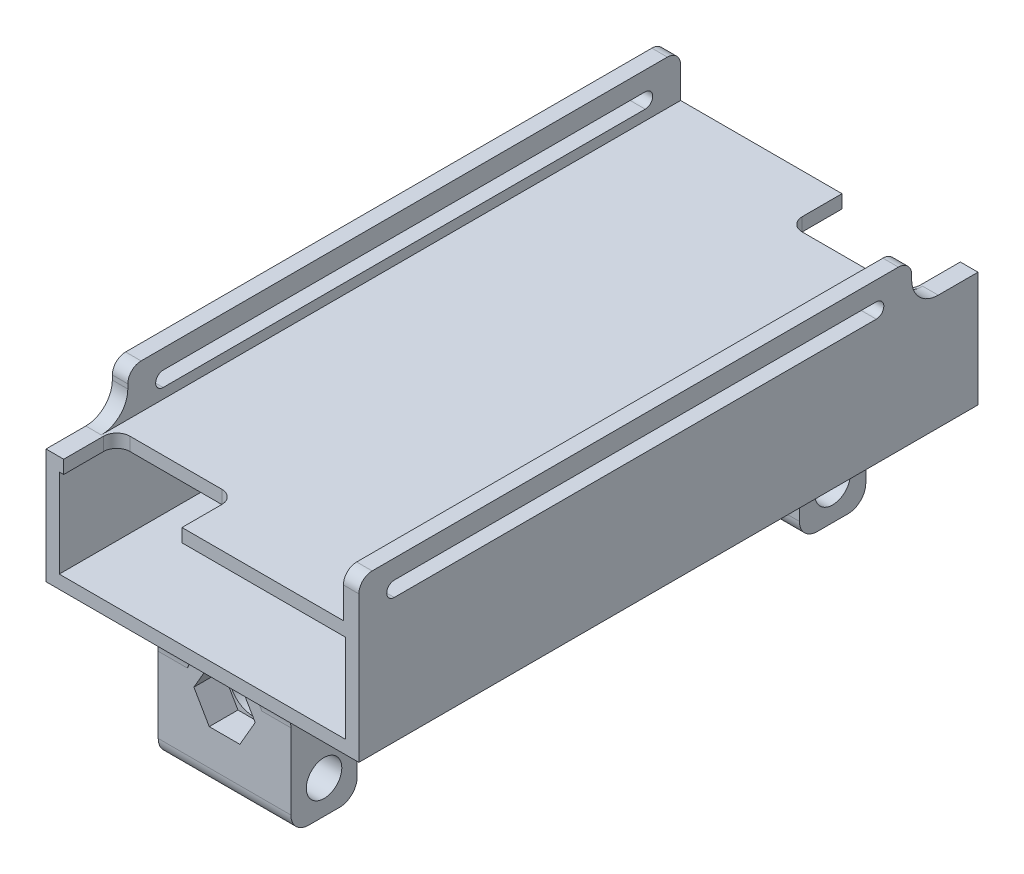
from build123d import *

# Parameters (mm, degrees)
SKETCH1_W            = 64.75
SKETCH1_H            = 20
BODY_DEPTH           = 140
SHELL1_T             = 3
SWITCH_CUTOUT_REACH  = 148.722
SKETCH2_W            = 26.75
SKETCH2_H            = 12
SKETCH4_W            = 15
SKETCH4_H            = 27
SKETCH4_R            = 4.0125
AXLE_HOLDER_DEPTH    = 15
SKETCH5_R            = 4.0125
SKETCH5_R_2          = 2.5
BUSHING_HOLDER_DEPTH = 9
FILLET3_R            = 4
FILLET4_R            = 6
SKETCH6_W            = 125
SKETCH6_H            = 10
SLIDE_MOUNT_DEPTH    = 3.5
CIRPATTERN1_COUNT    = 2
FILLET6_R            = 3
FILLET7_R            = 3
FILLET8_R            = 6
CUT_EXTRUDE1_REACH   = 147.177
SKETCH7_R            = 5.5
SKETCH8_R            = 8.916079783
CUT_EXTRUDE2_DEPTH   = 9
CUT_EXTRUDE3_DEPTH   = 3.5
CUT_EXTRUDE4_DEPTH   = 6.5


with BuildPart() as part:
    # Sketch1 → Body (new body)
    with BuildSketch(Plane.XY):
        Rectangle(SKETCH1_W, SKETCH1_H)
    extrude(amount=BODY_DEPTH)

    # Shell1
    shell1_openings = [part.faces().sort_by_distance(p)[0] for p in [
        (0, 0, 0),
        (0, 0, 140),
    ]]
    offset(amount=SHELL1_T, openings=shell1_openings, kind=Kind.INTERSECTION)

    # Sketch2 → Switch_cutout (cut, up to next)
    with BuildSketch(Plane(origin=(0, 13, 0), x_dir=(1, 0, 0), z_dir=(0, 1, 0)), mode=Mode.PRIVATE) as switch_cutout_sk1:
        with Locations((18, -6)):
            Rectangle(SKETCH2_W, SKETCH2_H)
    switch_cutout_tool1 = extrude(switch_cutout_sk1.sketch, amount=-SWITCH_CUTOUT_REACH, mode=Mode.PRIVATE) & part.part
    # Sketch2 → Switch_cutout (cut, up to next)
    with BuildSketch(Plane(origin=(0, 13, 0), x_dir=(1, 0, 0), z_dir=(0, 1, 0)), mode=Mode.PRIVATE) as switch_cutout_sk2:
        with Locations((-18, -134)):
            Rectangle(SKETCH2_W, SKETCH2_H)
    switch_cutout_tool2 = extrude(switch_cutout_sk2.sketch, amount=-SWITCH_CUTOUT_REACH, mode=Mode.PRIVATE) & part.part
    add(switch_cutout_tool1.solids().sort_by_distance((18, 13, 6))[0], mode=Mode.SUBTRACT)
    add(switch_cutout_tool2.solids().sort_by_distance((-18, 13, 134))[0], mode=Mode.SUBTRACT)

    # Sketch4 → Axle_holder (add, symmetric)
    # profile 1 of 2: a face of its own
    with BuildSketch(Plane.ZY):
        with Locations((12.5, -26.5)):
            Rectangle(SKETCH4_W, SKETCH4_H)
        with Locations(Location((12.5, -32.5, 0), (0, 0, 270))):
            Circle(SKETCH4_R, mode=Mode.SUBTRACT)
    # profile 2 of 2: a face of its own
    with BuildSketch(Plane.ZY):
        with Locations((127.5, -26.5)):
            Rectangle(SKETCH4_W, SKETCH4_H)
        with Locations(Location((127.5, -32.5, 0), (0, 0, 90))):
            Circle(SKETCH4_R, mode=Mode.SUBTRACT)
    extrude(amount=AXLE_HOLDER_DEPTH, both=True)

    # Sketch5 → Bushing_holder (add, symmetric)
    # profile 1 of 2: a face of its own
    with BuildSketch(Plane.ZY):
        with Locations(Location((12.5, -32.5, 0), (0, 0, 270))):
            Circle(SKETCH5_R)
        with Locations(Location((12.5, -32.5, 0), (0, 0, 270))):
            Circle(SKETCH5_R_2, mode=Mode.SUBTRACT)
    # profile 2 of 2: a face of its own
    with BuildSketch(Plane.ZY):
        with Locations(Location((127.5, -32.5, 0), (0, 0, 90))):
            Circle(SKETCH5_R)
        with Locations(Location((127.5, -32.5, 0), (0, 0, 270))):
            Circle(SKETCH5_R_2, mode=Mode.SUBTRACT)
    extrude(amount=BUSHING_HOLDER_DEPTH, both=True)

    # Fillet3
    fillet3_edges = [part.edges().sort_by_distance(p)[0] for p in [
        (0, -40, 5),
        (0, -40, 20),
        (0, -40, 135),
        (0, -40, 120),
    ]]
    fillet(fillet3_edges, radius=FILLET3_R)

    # Fillet4
    # the kernel refuses this fillet: 6 mm, written as the material it adds along each edge
    with BuildSketch(Plane(origin=(15, -13, 5), x_dir=(0, 0, -1), z_dir=(-1, 0, 0))) as fillet4_piece_1:
        with BuildLine():
            CenterArc((6, 5.916079783), FILLET4_R, 180, 80.405931773)
            Line((0, 5.916079783), (-0.12, 5.916079783))
            Line((-0.12, 5.916079783), (-0.12, 0))
            Line((-0.12, 0), (0, -0.12))
            ThreePointArc((0, -0.12), (2.5, -0.12), (4.98, -0.118321596))
            Line((4.98, -0.118321596), (5, 0))
        make_face()
    extrude(amount=30)
    with BuildSketch(Plane(origin=(-15, -13, 20), x_dir=(0, 0, 1), z_dir=(1, 0, 0)), Plane(origin=(-15, -13, 120), x_dir=(0, -1, 0), z_dir=(1, 0, 0))) as fillet4_piece_2:
        with BuildLine():
            CenterArc((FILLET4_R, FILLET4_R), FILLET4_R, 180, 90)
            Line((0, FILLET4_R), (-FILLET4_R * 0.02, FILLET4_R))
            Line((-FILLET4_R * 0.02, FILLET4_R), (-FILLET4_R * 0.02, -FILLET4_R * 0.02))
            Line((-FILLET4_R * 0.02, -FILLET4_R * 0.02), (FILLET4_R, -FILLET4_R * 0.02))
            Line((FILLET4_R, -FILLET4_R * 0.02), (FILLET4_R, 0))
        make_face()
    extrude(amount=30)
    with BuildSketch(Plane(origin=(15, -13, 135), x_dir=(0, 0, 1), z_dir=(-1, 0, 0))) as fillet4_piece_3:
        with BuildLine():
            CenterArc((6, -5.916079783), FILLET4_R, 99.594068227, 80.405931773)
            Line((0, -5.916079783), (-0.12, -5.916079783))
            Line((-0.12, -5.916079783), (-0.12, 0))
            Line((-0.12, 0), (0, 0.12))
            ThreePointArc((0, 0.12), (2.5, 0.12), (4.98, 0.118321596))
            Line((4.98, 0.118321596), (5, 0))
        make_face()
    extrude(amount=30)

    # Sketch6 → Slide_mount (add)
    with BuildSketch(Plane(origin=(35.375, 0, 0), x_dir=(0, 0, -1), z_dir=(1, 0, 0))):
        with Locations((-77.5, 18)):
            Rectangle(SKETCH6_W, SKETCH6_H)
        with BuildLine():
            Line((-132, 18.7), (-23, 18.7))
            ThreePointArc((-23, 18.7), (-21.3, 17), (-23, 15.3))
            Line((-23, 15.3), (-132, 15.3))
            ThreePointArc((-132, 15.3), (-133.7, 17), (-132, 18.7))
        make_face(mode=Mode.SUBTRACT)
    slide_mount = extrude(amount=-SLIDE_MOUNT_DEPTH)

    # CirPattern1: Slide_mount ×2 about axis
    cirpattern1_axis = Axis((0, 0, 70), (0, 1, 0))
    for i in range(1, CIRPATTERN1_COUNT):
        add(slide_mount.rotate(cirpattern1_axis, i * 360 / CIRPATTERN1_COUNT))

    # Fillet6
    fillet6_edges = [part.edges().sort_by_distance(p)[0] for p in [
        (33.625, 23, 140),
        (33.625, 23, 15),
        (-33.625, 23, 0),
        (-33.625, 23, 125),
    ]]
    fillet(fillet6_edges, radius=FILLET6_R)

    # Fillet7
    fillet7_edges = [part.edges().sort_by_distance(p)[0] for p in [
        (4.625, 11.5, 12),
        (31.375, 11.5, 12),
        (-31.375, 11.5, 128),
        (-4.625, 11.5, 128),
    ]]
    fillet(fillet7_edges, radius=FILLET7_R)

    # Fillet8
    fillet8_edges = [part.edges().sort_by_distance(p)[0] for p in [
        (33.625, 13, 15),
        (-33.625, 13, 125),
    ]]
    fillet(fillet8_edges, radius=FILLET8_R)

    # Sketch7 → Cut-Extrude1 (cut, up to next)
    with BuildSketch(Plane.XY.offset(135), mode=Mode.PRIVATE) as cut_extrude1_sk1:
        with Locations(Location((0, -21.916079783, 0), (0, 0, 32.018720622))):
            Circle(SKETCH7_R)
    cut_extrude1_tool1 = extrude(cut_extrude1_sk1.sketch, amount=-CUT_EXTRUDE1_REACH, mode=Mode.PRIVATE) & part.part
    add(cut_extrude1_tool1.solids().sort_by_distance((0, -21.91608, 135))[0], mode=Mode.SUBTRACT)

    # Sketch8 → Cut-Extrude2 (cut)
    with BuildSketch(Plane.XY.offset(135)):
        with Locations((0, -21.916079783)):
            Circle(SKETCH8_R)
    extrude(amount=CUT_EXTRUDE2_DEPTH, mode=Mode.SUBTRACT)

    # Sketch9 → Cut-Extrude3 (cut, symmetric)
    with BuildSketch(Plane(origin=(0, 0, 120), x_dir=(-1, 0, 0), z_dir=(0, 0, -1))):
        Polygon((-9.814954576, -21.916079783), (-4.907477288, -30.416079783), (4.907477288, -30.416079783), (9.814954576, -21.916079783), (4.907477288, -13.416079783), (-4.907477288, -13.416079783), align=None)
    extrude(amount=CUT_EXTRUDE3_DEPTH, both=True, mode=Mode.SUBTRACT)

    # Sketch10 → Cut-Extrude4 (cut)
    with BuildSketch(Plane.XY.offset(135)):
        Polygon((3.464101615, -15.916079783), (-3.464101615, -15.916079783), (-6.92820323, -21.916079783), (-3.464101615, -27.916079783), (3.464101615, -27.916079783), (6.92820323, -21.916079783), align=None)
    extrude(amount=-CUT_EXTRUDE4_DEPTH, mode=Mode.SUBTRACT)


solid = part.part
